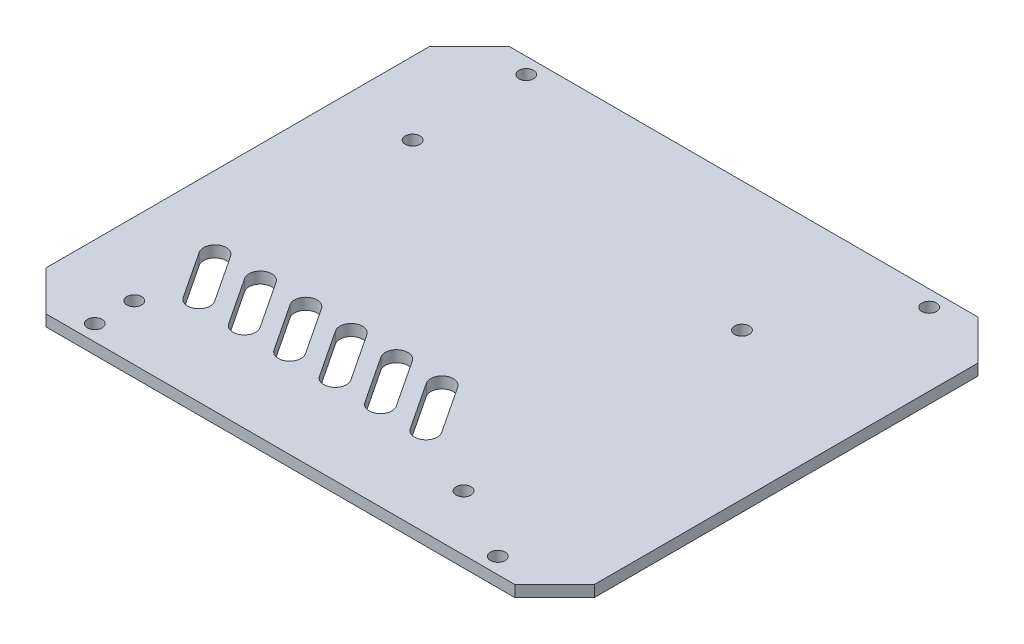
from build123d import *

# Parameters (mm, degrees)
EXTRUDE_1_DEPTH     = 2
CUT_EXTRUDE_1_REACH = 72.175
SKETCH_2_R          = 1.3
CUT_EXTRUDE_2_REACH = 72.175
SKETCH_3_R          = 1.3
CUT_EXTRUDE_3_REACH = 72.175


with BuildPart() as part:
    # 草图1 → 凸台-拉伸1 (new body)
    with BuildSketch(Plane.XZ.offset(19.39)):
        Polygon((-51.8, -40.295836944), (-44.795836944, -47.3), (37.795836944, -47.3), (44.8, -40.295836944), (44.8, 27.295836944), (37.795836944, 34.3), (-44.795836944, 34.3), (-51.8, 27.295836944), align=None)
    extrude(amount=EXTRUDE_1_DEPTH)

    # 草图2 → 切除-拉伸1 (cut, up to next)
    with BuildSketch(Plane.XZ.offset(21.39), mode=Mode.PRIVATE) as cut_extrude_1_sk1:
        with Locations((-39.011567772, -24.5)):
            Circle(SKETCH_2_R)
    cut_extrude_1_tool1 = extrude(cut_extrude_1_sk1.sketch, amount=-CUT_EXTRUDE_1_REACH, mode=Mode.PRIVATE) & part.part
    # 草图2 → 切除-拉伸1 (cut, up to next)
    with BuildSketch(Plane.XZ.offset(21.39), mode=Mode.PRIVATE) as cut_extrude_1_sk2:
        with Locations((19, -24.5)):
            Circle(SKETCH_2_R)
    cut_extrude_1_tool2 = extrude(cut_extrude_1_sk2.sketch, amount=-CUT_EXTRUDE_1_REACH, mode=Mode.PRIVATE) & part.part
    # 草图2 → 切除-拉伸1 (cut, up to next)
    with BuildSketch(Plane.XZ.offset(21.39), mode=Mode.PRIVATE) as cut_extrude_1_sk3:
        with Locations((-39.011567772, 24.535212594)):
            Circle(SKETCH_2_R)
    cut_extrude_1_tool3 = extrude(cut_extrude_1_sk3.sketch, amount=-CUT_EXTRUDE_1_REACH, mode=Mode.PRIVATE) & part.part
    # 草图2 → 切除-拉伸1 (cut, up to next)
    with BuildSketch(Plane.XZ.offset(21.39), mode=Mode.PRIVATE) as cut_extrude_1_sk4:
        with Locations((19, 24.535212594)):
            Circle(SKETCH_2_R)
    cut_extrude_1_tool4 = extrude(cut_extrude_1_sk4.sketch, amount=-CUT_EXTRUDE_1_REACH, mode=Mode.PRIVATE) & part.part
    add(cut_extrude_1_tool1.solids().sort_by_distance((-39.011568, -21.39, -24.5))[0], mode=Mode.SUBTRACT)
    add(cut_extrude_1_tool2.solids().sort_by_distance((19, -21.39, -24.5))[0], mode=Mode.SUBTRACT)
    add(cut_extrude_1_tool3.solids().sort_by_distance((-39.011568, -21.39, 24.535213))[0], mode=Mode.SUBTRACT)
    add(cut_extrude_1_tool4.solids().sort_by_distance((19, -21.39, 24.535213))[0], mode=Mode.SUBTRACT)

    # 草图3 → 切除-拉伸2 (cut, up to next)
    with BuildSketch(Plane.XZ.offset(21.39), mode=Mode.PRIVATE) as cut_extrude_2_sk1:
        with Locations((32, -44.5)):
            Circle(SKETCH_3_R)
    cut_extrude_2_tool1 = extrude(cut_extrude_2_sk1.sketch, amount=-CUT_EXTRUDE_2_REACH, mode=Mode.PRIVATE) & part.part
    # 草图3 → 切除-拉伸2 (cut, up to next)
    with BuildSketch(Plane.XZ.offset(21.39), mode=Mode.PRIVATE) as cut_extrude_2_sk2:
        with Locations((-39, -44.5)):
            Circle(SKETCH_3_R)
    cut_extrude_2_tool2 = extrude(cut_extrude_2_sk2.sketch, amount=-CUT_EXTRUDE_2_REACH, mode=Mode.PRIVATE) & part.part
    # 草图3 → 切除-拉伸2 (cut, up to next)
    with BuildSketch(Plane.XZ.offset(21.39), mode=Mode.PRIVATE) as cut_extrude_2_sk3:
        with Locations((32, 31.5)):
            Circle(SKETCH_3_R)
    cut_extrude_2_tool3 = extrude(cut_extrude_2_sk3.sketch, amount=-CUT_EXTRUDE_2_REACH, mode=Mode.PRIVATE) & part.part
    # 草图3 → 切除-拉伸2 (cut, up to next)
    with BuildSketch(Plane.XZ.offset(21.39), mode=Mode.PRIVATE) as cut_extrude_2_sk4:
        with Locations((-39, 31.5)):
            Circle(SKETCH_3_R)
    cut_extrude_2_tool4 = extrude(cut_extrude_2_sk4.sketch, amount=-CUT_EXTRUDE_2_REACH, mode=Mode.PRIVATE) & part.part
    add(cut_extrude_2_tool1.solids().sort_by_distance((32, -21.39, -44.5))[0], mode=Mode.SUBTRACT)
    add(cut_extrude_2_tool2.solids().sort_by_distance((-39, -21.39, -44.5))[0], mode=Mode.SUBTRACT)
    add(cut_extrude_2_tool3.solids().sort_by_distance((32, -21.39, 31.5))[0], mode=Mode.SUBTRACT)
    add(cut_extrude_2_tool4.solids().sort_by_distance((-39, -21.39, 31.5))[0], mode=Mode.SUBTRACT)

    # 草图4 → 切除-拉伸3 (cut, up to next)
    with BuildSketch(Plane.XZ.offset(21.39), mode=Mode.PRIVATE) as cut_extrude_3_sk1:
        with BuildLine():
            Line((-40.69671065, 11.402772719), (-35.182847057, 19.74527284))
            ThreePointArc((-35.182847057, 19.74527284), (-32.411574314, 20.311000146), (-31.845847008, 17.539727403))
            Line((-31.845847008, 17.539727403), (-37.359710601, 9.197227281))
            ThreePointArc((-37.359710601, 9.197227281), (-40.130983344, 8.631499976), (-40.69671065, 11.402772719))
        make_face()
    cut_extrude_3_tool1 = extrude(cut_extrude_3_sk1.sketch, amount=-CUT_EXTRUDE_3_REACH, mode=Mode.PRIVATE) & part.part
    # 草图4 → 切除-拉伸3 (cut, up to next)
    with BuildSketch(Plane.XZ.offset(21.39), mode=Mode.PRIVATE) as cut_extrude_3_sk2:
        with BuildLine():
            Line((-32.69671065, 11.402772719), (-27.182847057, 19.74527284))
            ThreePointArc((-27.182847057, 19.74527284), (-24.411574314, 20.311000146), (-23.845847008, 17.539727403))
            Line((-23.845847008, 17.539727403), (-29.359710601, 9.197227281))
            ThreePointArc((-29.359710601, 9.197227281), (-32.130983344, 8.631499976), (-32.69671065, 11.402772719))
        make_face()
    cut_extrude_3_tool2 = extrude(cut_extrude_3_sk2.sketch, amount=-CUT_EXTRUDE_3_REACH, mode=Mode.PRIVATE) & part.part
    # 草图4 → 切除-拉伸3 (cut, up to next)
    with BuildSketch(Plane.XZ.offset(21.39), mode=Mode.PRIVATE) as cut_extrude_3_sk3:
        with BuildLine():
            Line((-24.69671065, 11.402772719), (-19.182847057, 19.74527284))
            ThreePointArc((-19.182847057, 19.74527284), (-16.411574314, 20.311000146), (-15.845847008, 17.539727403))
            Line((-15.845847008, 17.539727403), (-21.359710601, 9.197227281))
            ThreePointArc((-21.359710601, 9.197227281), (-24.130983344, 8.631499976), (-24.69671065, 11.402772719))
        make_face()
    cut_extrude_3_tool3 = extrude(cut_extrude_3_sk3.sketch, amount=-CUT_EXTRUDE_3_REACH, mode=Mode.PRIVATE) & part.part
    # 草图4 → 切除-拉伸3 (cut, up to next)
    with BuildSketch(Plane.XZ.offset(21.39), mode=Mode.PRIVATE) as cut_extrude_3_sk4:
        with BuildLine():
            Line((-16.69671065, 11.402772719), (-11.182847057, 19.74527284))
            ThreePointArc((-11.182847057, 19.74527284), (-8.411574314, 20.311000146), (-7.845847008, 17.539727403))
            Line((-7.845847008, 17.539727403), (-13.359710601, 9.197227281))
            ThreePointArc((-13.359710601, 9.197227281), (-16.130983344, 8.631499976), (-16.69671065, 11.402772719))
        make_face()
    cut_extrude_3_tool4 = extrude(cut_extrude_3_sk4.sketch, amount=-CUT_EXTRUDE_3_REACH, mode=Mode.PRIVATE) & part.part
    # 草图4 → 切除-拉伸3 (cut, up to next)
    with BuildSketch(Plane.XZ.offset(21.39), mode=Mode.PRIVATE) as cut_extrude_3_sk5:
        with BuildLine():
            Line((-8.69671065, 11.402772719), (-3.182847057, 19.74527284))
            ThreePointArc((-3.182847057, 19.74527284), (-0.411574314, 20.311000146), (0.154152992, 17.539727403))
            Line((0.154152992, 17.539727403), (-5.359710601, 9.197227281))
            ThreePointArc((-5.359710601, 9.197227281), (-8.130983344, 8.631499976), (-8.69671065, 11.402772719))
        make_face()
    cut_extrude_3_tool5 = extrude(cut_extrude_3_sk5.sketch, amount=-CUT_EXTRUDE_3_REACH, mode=Mode.PRIVATE) & part.part
    # 草图4 → 切除-拉伸3 (cut, up to next)
    with BuildSketch(Plane.XZ.offset(21.39), mode=Mode.PRIVATE) as cut_extrude_3_sk6:
        with BuildLine():
            Line((-0.69671065, 11.402772719), (4.817152943, 19.74527284))
            ThreePointArc((4.817152943, 19.74527284), (7.588425686, 20.311000146), (8.154152992, 17.539727403))
            Line((8.154152992, 17.539727403), (2.640289399, 9.197227281))
            ThreePointArc((2.640289399, 9.197227281), (-0.130983344, 8.631499976), (-0.69671065, 11.402772719))
        make_face()
    cut_extrude_3_tool6 = extrude(cut_extrude_3_sk6.sketch, amount=-CUT_EXTRUDE_3_REACH, mode=Mode.PRIVATE) & part.part
    add(cut_extrude_3_tool1.solids().sort_by_distance((-36.271279, -21.39, 14.47125))[0], mode=Mode.SUBTRACT)
    add(cut_extrude_3_tool2.solids().sort_by_distance((-28.271279, -21.39, 14.47125))[0], mode=Mode.SUBTRACT)
    add(cut_extrude_3_tool3.solids().sort_by_distance((-20.271279, -21.39, 14.47125))[0], mode=Mode.SUBTRACT)
    add(cut_extrude_3_tool4.solids().sort_by_distance((-12.271279, -21.39, 14.47125))[0], mode=Mode.SUBTRACT)
    add(cut_extrude_3_tool5.solids().sort_by_distance((-4.271279, -21.39, 14.47125))[0], mode=Mode.SUBTRACT)
    add(cut_extrude_3_tool6.solids().sort_by_distance((3.728721, -21.39, 14.47125))[0], mode=Mode.SUBTRACT)


solid = part.part
